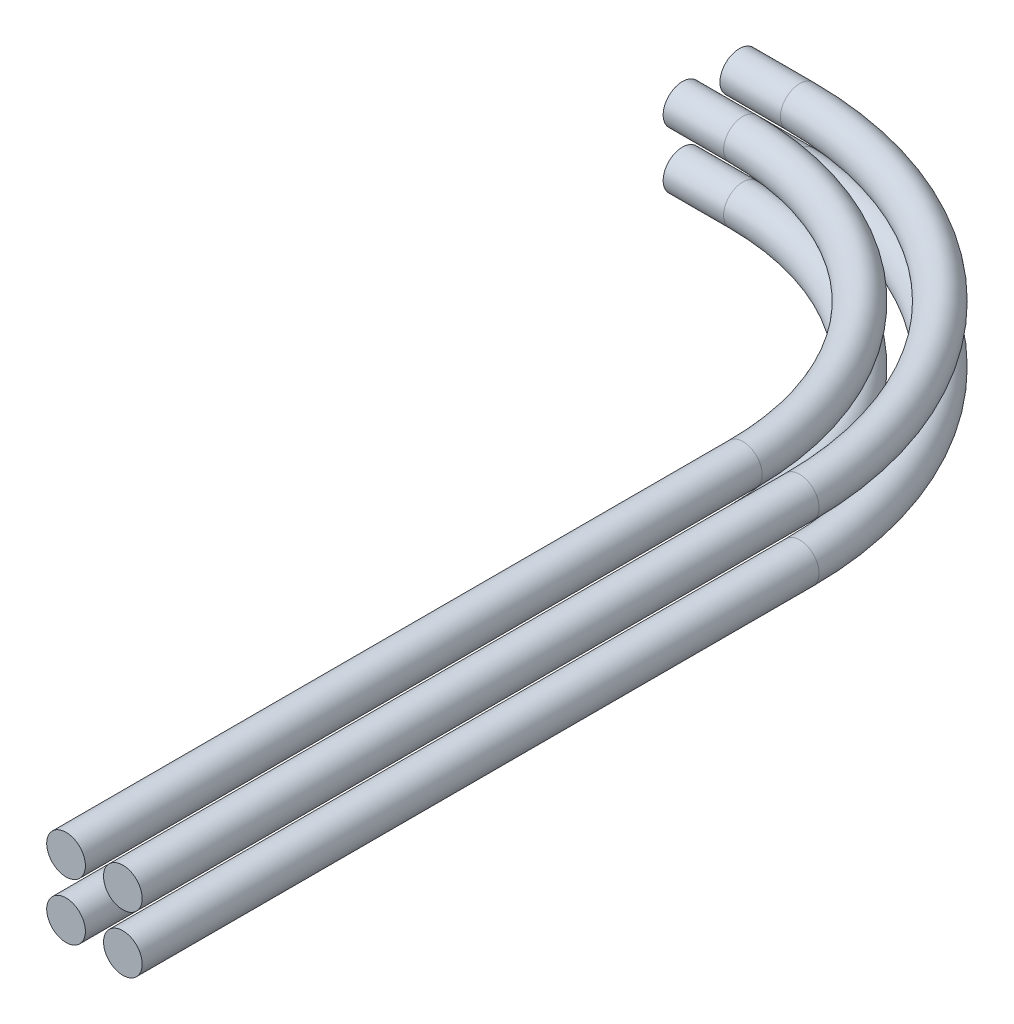
from build123d import *

# Parameters (mm, degrees)
SKETCH2_R       = 1.6
LPATTERN1_COUNT = 2
LPATTERN1_PITCH = 4.7


with BuildPart() as part:
    # Sweep1: sweep along a path in Sketch1
    with BuildLine(Plane(origin=(0, 0, 0), x_dir=(1, 0, 0), z_dir=(0, 1, 0))) as sweep1_path:
        Line((0, 0), (5, 0))
        ThreePointArc((5, 0), (24.798989873, -8.201010127), (33, -28))
        Line((33, -28), (33, -84))
    # Sketch2 → Sweep1 (sweep)
    with BuildSketch(Plane(origin=(0, 0, 0), x_dir=(0, 0, -1), z_dir=(1, 0, 0))):
        Circle(SKETCH2_R)
        with Locations((-4.7, 0)):
            Circle(SKETCH2_R)
    sweep1 = sweep(path=sweep1_path.line)


with BuildPart() as lpattern1_1:
    # LPattern1: Sweep1 ×2
    with Locations(*[(0, i * LPATTERN1_PITCH, 0) for i in range(1, LPATTERN1_COUNT)]):
        add(sweep1)


solid = Compound([part.part, lpattern1_1.part])
